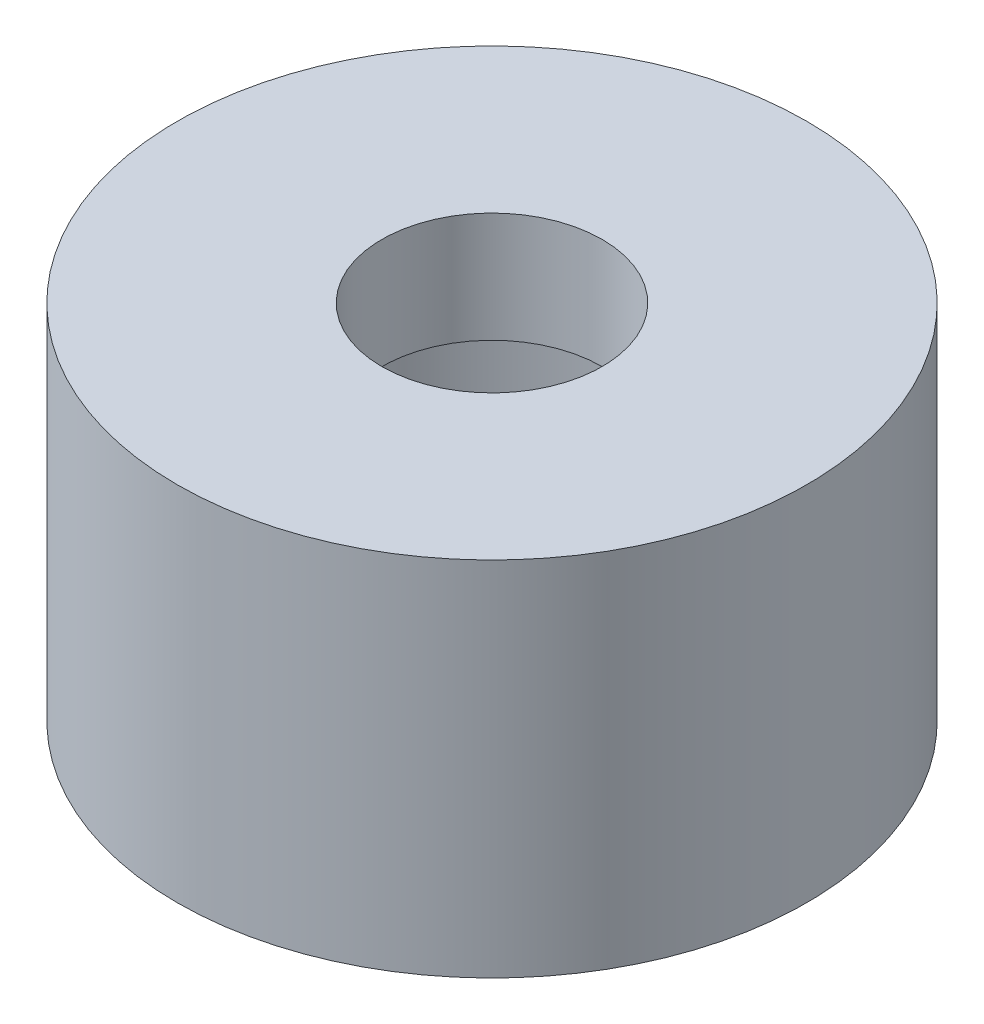
from build123d import *

# Parameters (mm, degrees)
SKETCH1_R           = 10
SKETCH1_R_2         = 7
BOSS_EXTRUDE1_DEPTH = 8
SKETCH2_R           = 10
SKETCH2_R_2         = 3.5
BOSS_EXTRUDE2_DEPTH = 3.5


with BuildPart() as part:
    # Sketch1 → Boss-Extrude1 (new body)
    with BuildSketch(Plane(origin=(0, 0, 0), x_dir=(1, 0, 0), z_dir=(0, 1, 0))):
        Circle(SKETCH1_R)
        Circle(SKETCH1_R_2, mode=Mode.SUBTRACT)
    extrude(amount=BOSS_EXTRUDE1_DEPTH)

    # Sketch2 → Boss-Extrude2 (add)
    with BuildSketch(Plane(origin=(0, 8, 0), x_dir=(1, 0, 0), z_dir=(0, 1, 0))):
        Circle(SKETCH2_R)
        Circle(SKETCH2_R_2, mode=Mode.SUBTRACT)
    extrude(amount=BOSS_EXTRUDE2_DEPTH)


solid = part.part
